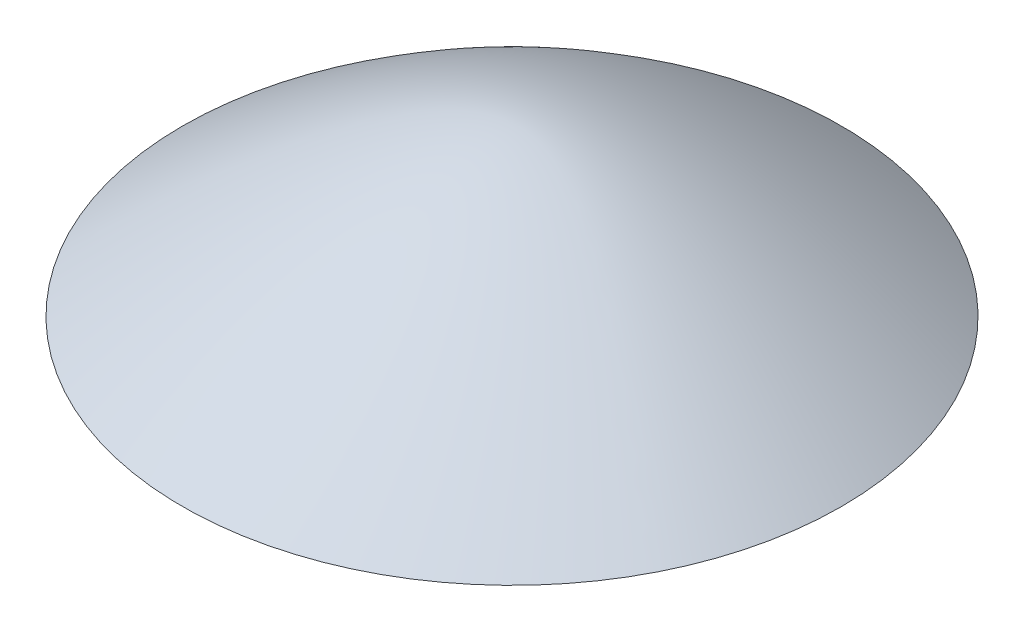
from build123d import *


with BuildPart() as part:
    # Sketch3 → Revolve1 (revolve)
    with BuildSketch(Plane.XY):
        with BuildLine():
            add(Edge.make_bspline(
                [(10, 0), (3.201562119, 5), (0, 5)],
                knots=[0, 0, 0, 1, 1, 1], degree=2))
            Line((0, 5), (0, 0))
            Line((0, 0), (2.5, 0))
            Line((2.5, 0), (2.5, 0.5))
            Line((2.5, 0.5), (0.75, 0.5))
            Line((0.75, 0.5), (0.75, 4.566302548))
            add(Edge.make_bspline(
                [(9.6, 0), (4.481603465, 3.295987071), (2.773178216, 4.373050155), (0.75, 4.566302548)],
                knots=[0, 0, 0, 0, 0.892656929, 0.892656929, 0.892656929, 0.892656929], degree=3))
            Line((9.6, 0), (10, 0))
        make_face()
    revolve(axis=Axis((0, 5, 0), (0, -1, 0)))


solid = part.part
